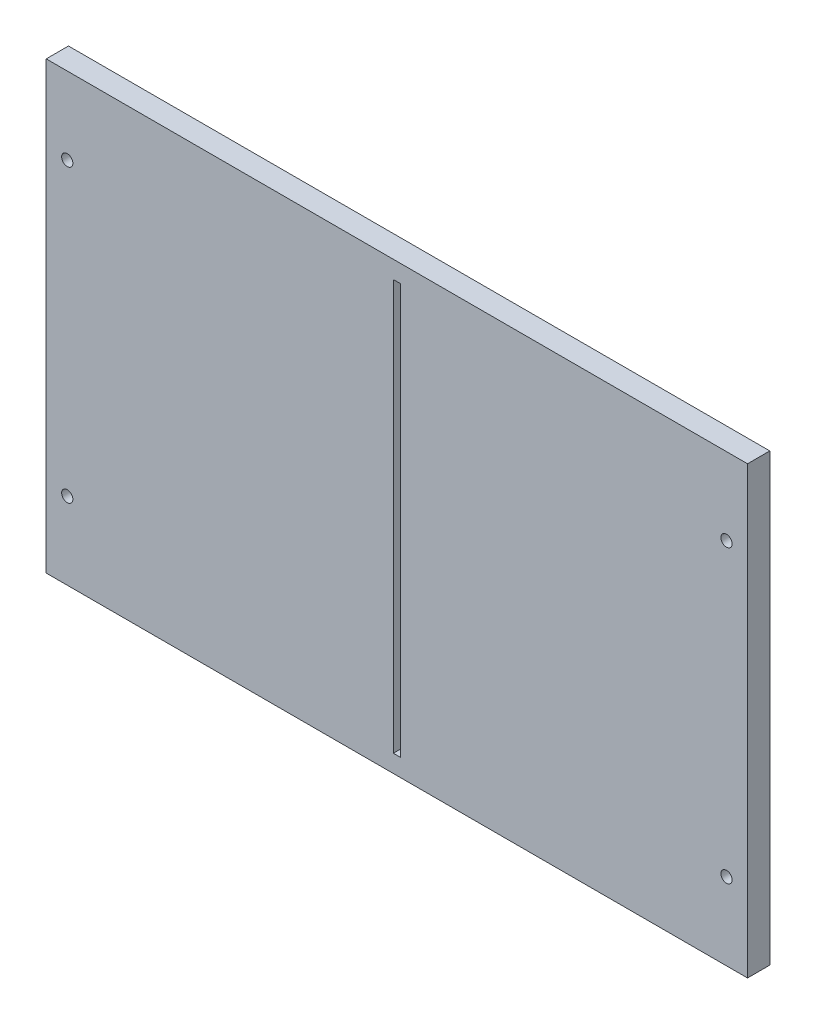
from build123d import *

# Parameters (mm, degrees)
SKETCH1_W          = 200
SKETCH1_H          = 127
SKETCH1_R          = 1.6
WALL_DEPTH         = 6.35
SKETCH6_W          = 2
SKETCH6_H          = 117
CUT_EXTRUDE1_DEPTH = 238.000680379


with BuildPart() as part:
    # Sketch1 → Wall (new body)
    with BuildSketch(Plane.XY):
        with Locations((100, 63.5)):
            Rectangle(SKETCH1_W, SKETCH1_H)
        with Locations((6, 105)):
            Circle(SKETCH1_R, mode=Mode.SUBTRACT)
        with Locations((194, 105)):
            Circle(SKETCH1_R, mode=Mode.SUBTRACT)
        with Locations((194, 22)):
            Circle(SKETCH1_R, mode=Mode.SUBTRACT)
        with Locations((6, 22)):
            Circle(SKETCH1_R, mode=Mode.SUBTRACT)
    extrude(amount=WALL_DEPTH)

    # Sketch6 → Cut-Extrude1 (cut, through all)
    with BuildSketch(Plane.XY.offset(6.35)):
        with Locations((100, 63.5)):
            Rectangle(SKETCH6_W, SKETCH6_H)
    extrude(amount=-CUT_EXTRUDE1_DEPTH, mode=Mode.SUBTRACT)


solid = part.part
